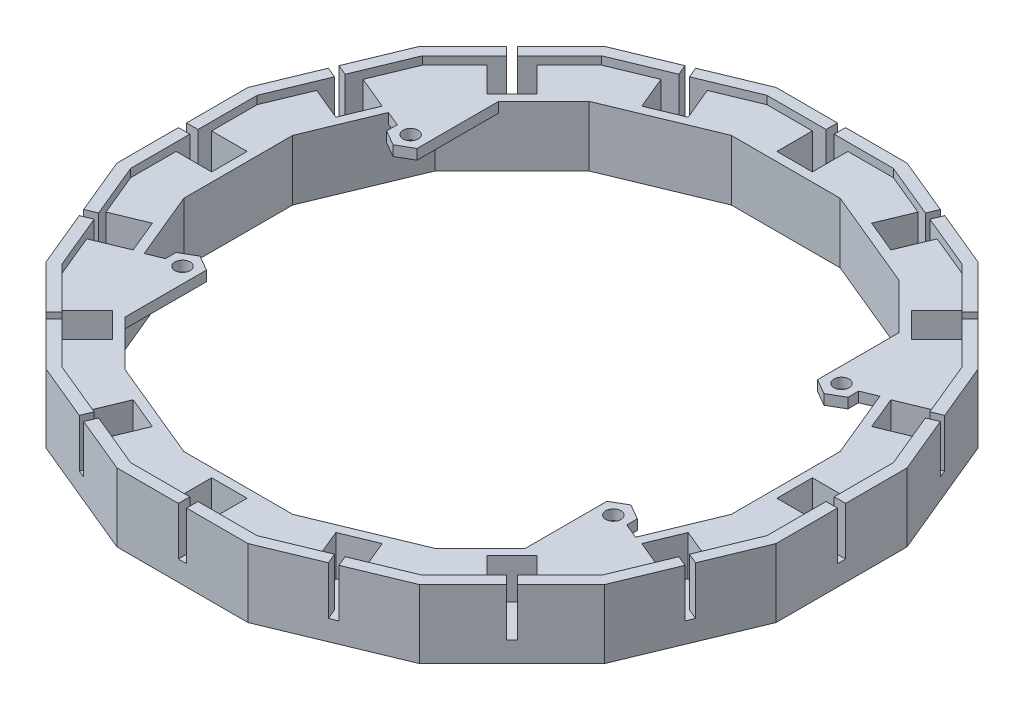
from build123d import *

# Parameters (mm, degrees)
BOSS_EXTRUDE1_DEPTH = 13.5
CUT_EXTRUDE1_DEPTH  = 1.6
CUT_EXTRUDE2_DEPTH  = 9.5
SKETCH5_R           = 1.5
BOSS_EXTRUDE2_DEPTH = 2
CHAMFER1_SIZE       = 8


with BuildPart() as part:
    # Sketch1 → Boss-Extrude1 (new body)
    with BuildSketch(Plane(origin=(0, 0, 0), x_dir=(1, 0, 0), z_dir=(0, 1, 0))):
        Polygon((55.104339226, 36.819542328), (36.819542328, 55.104339226), (12.92930388, 65), (-12.92930388, 65), (-36.819542328, 55.104339226), (-55.104339226, 36.819542328), (-65, 12.92930388), (-65, -12.92930388), (-55.104339226, -36.819542328), (-36.819542328, -55.104339226), (-12.92930388, -65), (12.92930388, -65), (36.819542328, -55.104339226), (55.104339226, -36.819542328), (65, -12.92930388), (65, 12.92930388), align=None)
        Polygon((10.741267839, 54), (-10.741267839, 54), (-30.588542857, 45.778989511), (-45.778989511, 30.588542857), (-54, 10.741267839), (-54, -10.741267839), (-45.778989511, -30.588542857), (-30.588542857, -45.778989511), (-10.741267839, -54), (10.741267839, -54), (30.588542857, -45.778989511), (45.778989511, -30.588542857), (54, -10.741267839), (54, 10.741267839), (45.778989511, 30.588542857), (30.588542857, 45.778989511), align=None, mode=Mode.SUBTRACT)
    extrude(amount=BOSS_EXTRUDE1_DEPTH)

    # Sketch2 → Cut-Extrude1 (cut)
    with BuildSketch(Plane(origin=(0, 13.5, 0), x_dir=(1, 0, 0), z_dir=(0, 1, 0))):
        Polygon((35.545019709, 53.19688133), (12.481751053, 62.75), (-12.481751053, 62.75), (-35.545019709, 53.19688133), (-53.19688133, 35.545019709), (-62.75, 12.481751053), (-62.75, -12.481751053), (-53.19688133, -35.545019709), (-35.545019709, -53.19688133), (-12.481751053, -62.75), (12.481751053, -62.75), (35.545019709, -53.19688133), (53.19688133, -35.545019709), (62.75, -12.481751053), (62.75, 12.481751053), (53.19688133, 35.545019709), align=None)
    extrude(amount=-CUT_EXTRUDE1_DEPTH, mode=Mode.SUBTRACT)

    # Sketch3 → Cut-Extrude2 (cut)
    with BuildSketch(Plane(origin=(0, 13.5, 0), x_dir=(1, 0, 0), z_dir=(0, 1, 0))):
        Polygon((-3.5, 62.75), (-0.8, 62.75), (-0.8, 65), (0.8, 65), (0.8, 62.75), (3.5, 62.75), (3.5, 55.75), (-3.5, 55.75), align=None)
        Polygon((20.779807017, 59.312832678), (23.274281755, 58.279587411), (24.135319478, 60.358316359), (25.61352673, 59.746022867), (24.752489007, 57.667293919), (27.246963745, 56.634048652), (24.568179718, 50.166891924), (18.101022991, 52.845675951), align=None)
        Polygon((41.896076785, 46.845824254), (43.805265095, 44.936635944), (45.396255352, 46.527626202), (46.527626202, 45.396255352), (44.936635944, 43.805265095), (46.845824254, 41.896076785), (41.896076785, 36.946329317), (36.946329317, 41.896076785), align=None)
        Polygon((56.634048652, 27.246963745), (57.667293919, 24.752489007), (59.746022867, 25.61352673), (60.358316359, 24.135319478), (58.279587411, 23.274281755), (59.312832678, 20.779807017), (52.845675951, 18.101022991), (50.166891924, 24.568179718), align=None)
        Polygon((62.75, 3.5), (62.75, 0.8), (65, 0.8), (65, -0.8), (62.75, -0.8), (62.75, -3.5), (55.75, -3.5), (55.75, 3.5), align=None)
        Polygon((59.312832678, -20.779807017), (58.279587411, -23.274281755), (60.358316359, -24.135319478), (59.746022867, -25.61352673), (57.667293919, -24.752489007), (56.634048652, -27.246963745), (50.166891924, -24.568179718), (52.845675951, -18.101022991), align=None)
        Polygon((46.845824254, -41.896076785), (44.936635944, -43.805265095), (46.527626202, -45.396255352), (45.396255352, -46.527626202), (43.805265095, -44.936635944), (41.896076785, -46.845824254), (36.946329317, -41.896076785), (41.896076785, -36.946329317), align=None)
        Polygon((27.246963745, -56.634048652), (24.752489007, -57.667293919), (25.61352673, -59.746022867), (24.135319478, -60.358316359), (23.274281755, -58.279587411), (20.779807017, -59.312832678), (18.101022991, -52.845675951), (24.568179718, -50.166891924), align=None)
        Polygon((3.5, -62.75), (0.8, -62.75), (0.8, -65), (-0.8, -65), (-0.8, -62.75), (-3.5, -62.75), (-3.5, -55.75), (3.5, -55.75), align=None)
        Polygon((-20.779807017, -59.312832678), (-23.274281755, -58.279587411), (-24.135319478, -60.358316359), (-25.61352673, -59.746022867), (-24.752489007, -57.667293919), (-27.246963745, -56.634048652), (-24.568179718, -50.166891924), (-18.101022991, -52.845675951), align=None)
        Polygon((-41.896076785, -46.845824254), (-43.805265095, -44.936635944), (-45.396255352, -46.527626202), (-46.527626202, -45.396255352), (-44.936635944, -43.805265095), (-46.845824254, -41.896076785), (-41.896076785, -36.946329317), (-36.946329317, -41.896076785), align=None)
        Polygon((-56.634048652, -27.246963745), (-57.667293919, -24.752489007), (-59.746022867, -25.61352673), (-60.358316359, -24.135319478), (-58.279587411, -23.274281755), (-59.312832678, -20.779807017), (-52.845675951, -18.101022991), (-50.166891924, -24.568179718), align=None)
        Polygon((-62.75, -3.5), (-62.75, -0.8), (-65, -0.8), (-65, 0.8), (-62.75, 0.8), (-62.75, 3.5), (-55.75, 3.5), (-55.75, -3.5), align=None)
        Polygon((-59.312832678, 20.779807017), (-58.279587411, 23.274281755), (-60.358316359, 24.135319478), (-59.746022867, 25.61352673), (-57.667293919, 24.752489007), (-56.634048652, 27.246963745), (-50.166891924, 24.568179718), (-52.845675951, 18.101022991), align=None)
        Polygon((-46.845824254, 41.896076785), (-44.936635944, 43.805265095), (-46.527626202, 45.396255352), (-45.396255352, 46.527626202), (-43.805265095, 44.936635944), (-41.896076785, 46.845824254), (-36.946329317, 41.896076785), (-41.896076785, 36.946329317), align=None)
        Polygon((-27.246963745, 56.634048652), (-24.752489007, 57.667293919), (-25.61352673, 59.746022867), (-24.135319478, 60.358316359), (-23.274281755, 58.279587411), (-20.779807017, 59.312832678), (-18.101022991, 52.845675951), (-24.568179718, 50.166891924), align=None)
    extrude(amount=-CUT_EXTRUDE2_DEPTH, mode=Mode.SUBTRACT)

    # Sketch5 → Boss-Extrude2 (add)
    # profile 1 of 4: a face of its own
    with BuildSketch(Plane(origin=(0, 11.9, 0), x_dir=(1, 0, 0), z_dir=(0, 1, 0))):
        Polygon((-39.5, 24.232050808), (-39.5, 36.867532368), (-45.5, 30.867532368), (-45.5, 24.232050808), (-45.5, 20.767949192), (-42.5, 19.035898385), (-39.5, 20.767949192), align=None)
        with Locations(Location((-42.5, 22.5, 0), (0, 0, 270))):
            Circle(SKETCH5_R, mode=Mode.SUBTRACT)
    # profile 2 of 4: a face of its own
    with BuildSketch(Plane(origin=(0, 11.9, 0), x_dir=(1, 0, 0), z_dir=(0, 1, 0))):
        Polygon((-45.5, -24.232050808), (-45.5, -30.867532368), (-39.5, -36.867532368), (-39.5, -24.232050808), (-39.5, -20.767949192), (-42.5, -19.035898385), (-45.5, -20.767949192), align=None)
        with Locations(Location((-42.5, -22.5, 0), (0, 0, 270))):
            Circle(SKETCH5_R, mode=Mode.SUBTRACT)
    # profile 3 of 4: a face of its own
    with BuildSketch(Plane(origin=(0, 11.9, 0), x_dir=(1, 0, 0), z_dir=(0, 1, 0))):
        Polygon((45.5, -24.232050808), (45.5, -20.767949192), (42.5, -19.035898385), (39.5, -20.767949192), (39.5, -24.232050808), (39.5, -36.867532368), (45.5, -30.867532368), align=None)
        with Locations(Location((42.5, -22.5, 0), (0, 0, 270))):
            Circle(SKETCH5_R, mode=Mode.SUBTRACT)
    # profile 4 of 4: a face of its own
    with BuildSketch(Plane(origin=(0, 11.9, 0), x_dir=(1, 0, 0), z_dir=(0, 1, 0))):
        Polygon((45.5, 24.232050808), (45.5, 30.867532368), (39.5, 36.867532368), (39.5, 24.232050808), (39.5, 20.767949192), (42.5, 19.035898385), (45.5, 20.767949192), align=None)
        with Locations(Location((42.5, 22.5, 0), (0, 0, 270))):
            Circle(SKETCH5_R, mode=Mode.SUBTRACT)
    extrude(amount=-BOSS_EXTRUDE2_DEPTH)

    # Chamfer1
    # the kernel refuses this chamfer: 8 mm, written as the material it adds along each edge
    with BuildSketch(Plane(origin=(45.5, 11.9, -30.867532368), x_dir=(0.7323591110720671, 0, 0.6809185945689336), z_dir=(0, -1, 0)), Plane(origin=(-45.5, 11.9, 30.867532368), x_dir=(-0.7323591110720654, 0, -0.6809185945689354), z_dir=(0, -1, 0))) as chamfer1_piece_1:
        Polygon((CHAMFER1_SIZE * 0.999338249359, CHAMFER1_SIZE * 0.0363739380471), (CHAMFER1_SIZE * 0.680918594569, CHAMFER1_SIZE * 0.732359111072), (0, 0), align=None)
    extrude(amount=2)
    with BuildSketch(Plane(origin=(45.5, 11.9, 30.867532368), x_dir=(0.7323591110720631, 0, -0.680918594568938), z_dir=(0, -1, 0)), Plane(origin=(-45.5, 11.9, -30.867532368), x_dir=(-0.732359111072063, 0, 0.6809185945689378), z_dir=(0, -1, 0))) as chamfer1_piece_2:
        Polygon((CHAMFER1_SIZE * 0.999338249359, -CHAMFER1_SIZE * 0.0363739380471), (CHAMFER1_SIZE * 0.680918594569, -CHAMFER1_SIZE * 0.732359111072), (0, 0), align=None)
    extrude(amount=2)


solid = part.part
